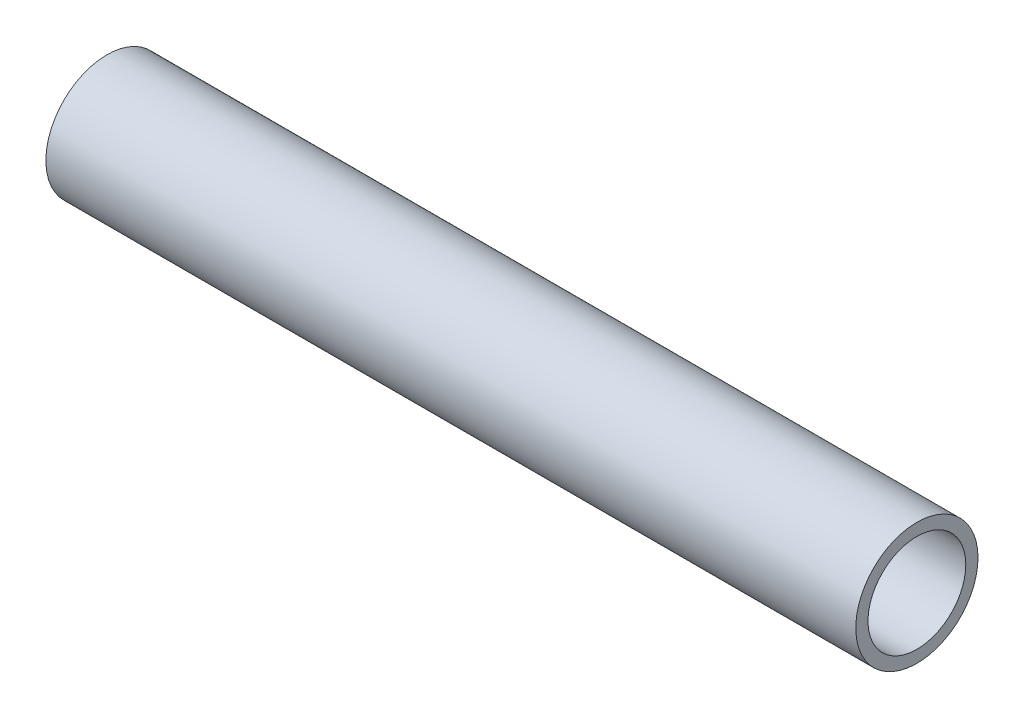
from build123d import *

# Parameters (mm, degrees)
SKETCH1_R           = 15.875
SKETCH1_R_2         = 12.7
EXTRUDE_THIN1_DEPTH = 105.1745


with BuildPart() as part:
    # Sketch1 → Extrude-Thin1 (new, symmetric)
    with BuildSketch(Plane(origin=(0, 0, 0), x_dir=(0, 0, -1), z_dir=(1, 0, 0))):
        Circle(SKETCH1_R)
        Circle(SKETCH1_R_2, mode=Mode.SUBTRACT)
    extrude(amount=EXTRUDE_THIN1_DEPTH, both=True)


solid = part.part
